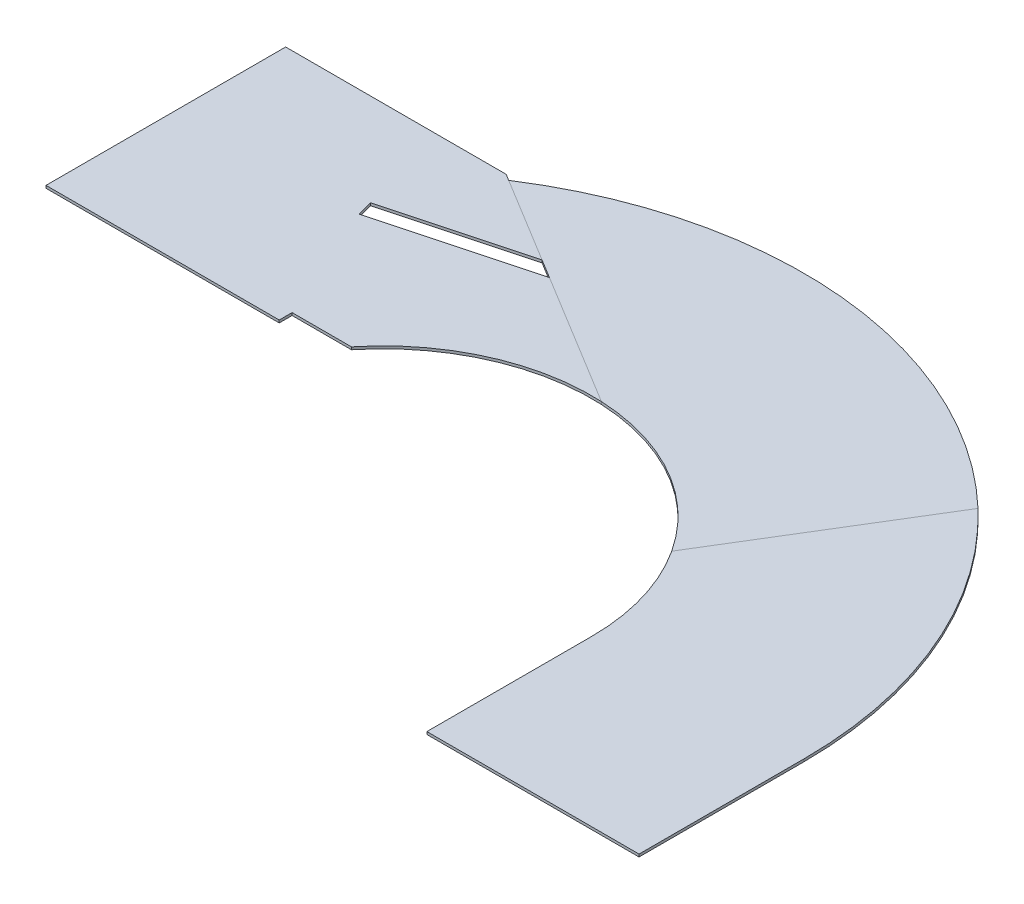
from build123d import *

# Parameters (mm, degrees)
BOSS_EXTRUDE1_DEPTH = 3.18
CUT_EXTRUDE1_DEPTH  = 771.485416357
CUT_EXTRUDE2_DEPTH  = 771.485416357


# Read off the part's stored shape, not the designer's step: Split3
with BuildPart() as part:
    # Sketch1 → Boss-Extrude1 (new body)
    with BuildSketch(Plane(origin=(0, 0, 0), x_dir=(1, 0, 0), z_dir=(0, 1, 0))):
        with BuildLine():
            Line((-565.781463482, 444.38), (-275.781463482, 444.38))
            ThreePointArc((-275.781463482, 444.38), (254.259016162, 457.035395457), (523, 0))
            Line((523, 0), (523, -205))
            Line((523, -205), (259.175, -205))
            Line((259.175, -205), (259.175, 0))
            ThreePointArc((259.175, 0), (86.075732957, 244.464003119), (-202.001030257, 162.38))
            Line((-202.001030257, 162.38), (-275.781463482, 162.38))
            Line((-275.781463482, 162.38), (-275.781463482, 146.38))
            Line((-275.781463482, 146.38), (-565.781463482, 146.38))
            Line((-565.781463482, 146.38), (-565.781463482, 162.38))
            Line((-565.781463482, 162.38), (-565.781463482, 444.38))
        make_face()
    extrude(amount=BOSS_EXTRUDE1_DEPTH)


with BuildPart() as body_2:
    # Split2: the piece on the far side of the plane
    add(part.part)
    split(bisect_by=Plane(origin=(95.313758644, 0, 58.173323286), x_dir=(0.5209675909432273, 0, -0.8535764577276076), z_dir=(-0.8535764577276076, 0, -0.5209675909432273)), keep=Keep.BOTTOM)


with BuildPart() as part_1:
    add(part.part)

    # Split2
    split(bisect_by=Plane(origin=(95.313758644, 0, 58.173323286), x_dir=(0.5209675909432273, 0, -0.8535764577276076), z_dir=(-0.8535764577276076, 0, -0.5209675909432273)), keep=Keep.TOP)


with BuildPart() as body_3:
    # Split3: the piece on the far side of the plane
    add(part_1.part)
    split(bisect_by=Plane(origin=(118.465339809, 0, -194.098878463), x_dir=(0.8535764577276066, 0, 0.5209675909432288), z_dir=(0.5209675909432288, 0, -0.8535764577276067)), keep=Keep.BOTTOM)

    # Sketch5 → Cut-Extrude2 (cut, through all)
    with BuildSketch(Plane.XZ):
        Polygon((-340, -310), (-345.176380902, -329.318516526), (-94.035666067, -396.611468252), (-88.859285165, -377.292951727), align=None)
    extrude(amount=-CUT_EXTRUDE2_DEPTH, mode=Mode.SUBTRACT)


with BuildPart() as part_2:
    add(part_1.part)

    # Split3
    split(bisect_by=Plane(origin=(118.465339809, 0, -194.098878463), x_dir=(0.8535764577276066, 0, 0.5209675909432288), z_dir=(0.5209675909432288, 0, -0.8535764577276067)), keep=Keep.TOP)

    # Sketch4 → Cut-Extrude1 (cut, through all)
    with BuildSketch(Plane(origin=(0, 3.18, 0), x_dir=(1, 0, 0), z_dir=(0, 1, 0))):
        with BuildLine():
            Line((-291.606374577, 444.38), (-283.55067597, 439.463325156))
            ThreePointArc((-283.55067597, 439.463325156), (-279.676874229, 441.938735597), (-275.781463482, 444.38))
            Line((-275.781463482, 444.38), (-291.606374577, 444.38))
        make_face()
    extrude(amount=-CUT_EXTRUDE1_DEPTH, mode=Mode.SUBTRACT)


solid = Compound([body_2.part, body_3.part, part_2.part])
